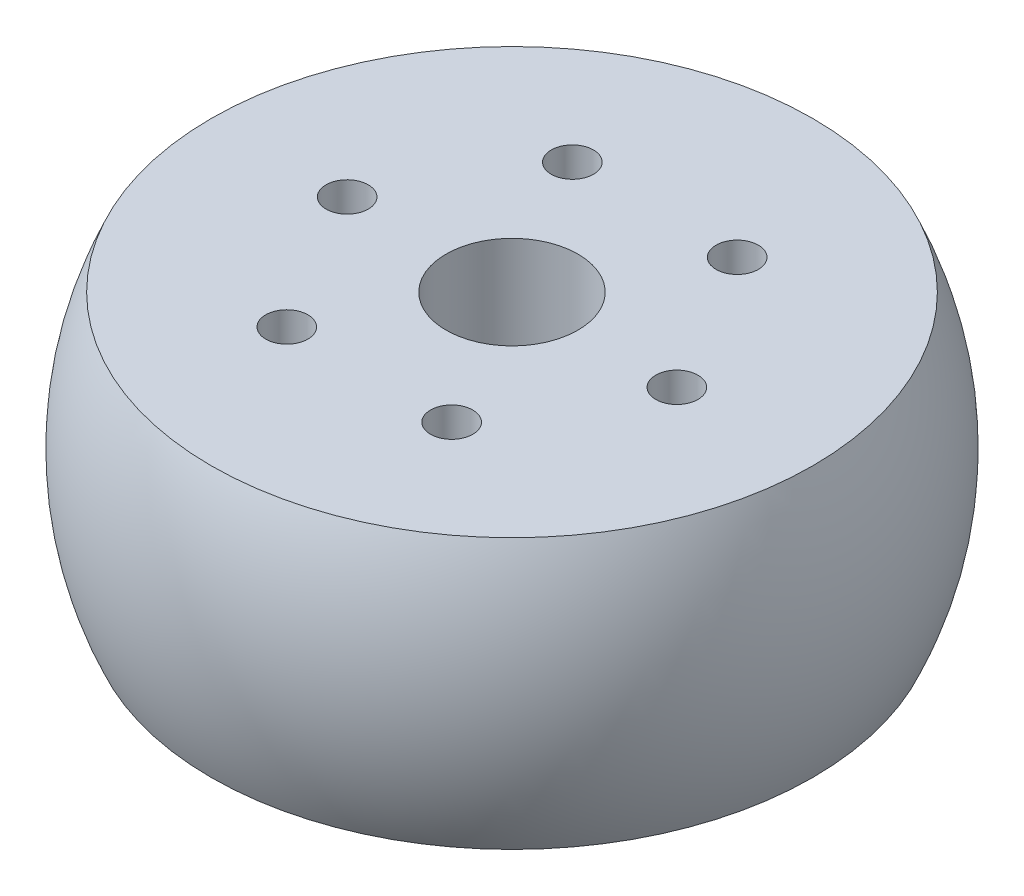
from build123d import *

# Parameters (mm, degrees)
SKETCH3_R          = 1.016
CUT_EXTRUDE1_DEPTH = 24.372660311
CIRPATTERN1_COUNT  = 6


with BuildPart() as part:
    # Sketch1 → Revolve1 (revolve)
    with BuildSketch(Plane(origin=(0, 0, 0), x_dir=(0, 0, -1), z_dir=(1, 0, 0))):
        with BuildLine():
            Line((3.175, 6.5), (14.483287783, 6.5))
            ThreePointArc((14.483287783, 6.5), (15.875, 0), (14.483287783, -6.5))
            Line((14.483287783, -6.5), (3.175, -6.5))
            Line((3.175, -6.5), (3.175, 6.5))
        make_face()
    revolve(axis=Axis((0, -6.5, 0), (0, 1, 0)))

    # Sketch3 → Cut-Extrude1 (cut, symmetric)
    with BuildSketch(Plane(origin=(0, 0, 0), x_dir=(1, 0, 0), z_dir=(0, 1, 0))):
        with Locations((7.9375, 0)):
            Circle(SKETCH3_R)
    cut_extrude1 = extrude(amount=CUT_EXTRUDE1_DEPTH, both=True, mode=Mode.SUBTRACT)

    # CirPattern1: Cut-Extrude1 ×6 about axis
    cirpattern1_axis = Axis((0, -6.5, 0), (0, -1, 0))
    for i in range(1, CIRPATTERN1_COUNT):
        add(cut_extrude1.rotate(cirpattern1_axis, i * 360 / CIRPATTERN1_COUNT), mode=Mode.SUBTRACT)


solid = part.part
